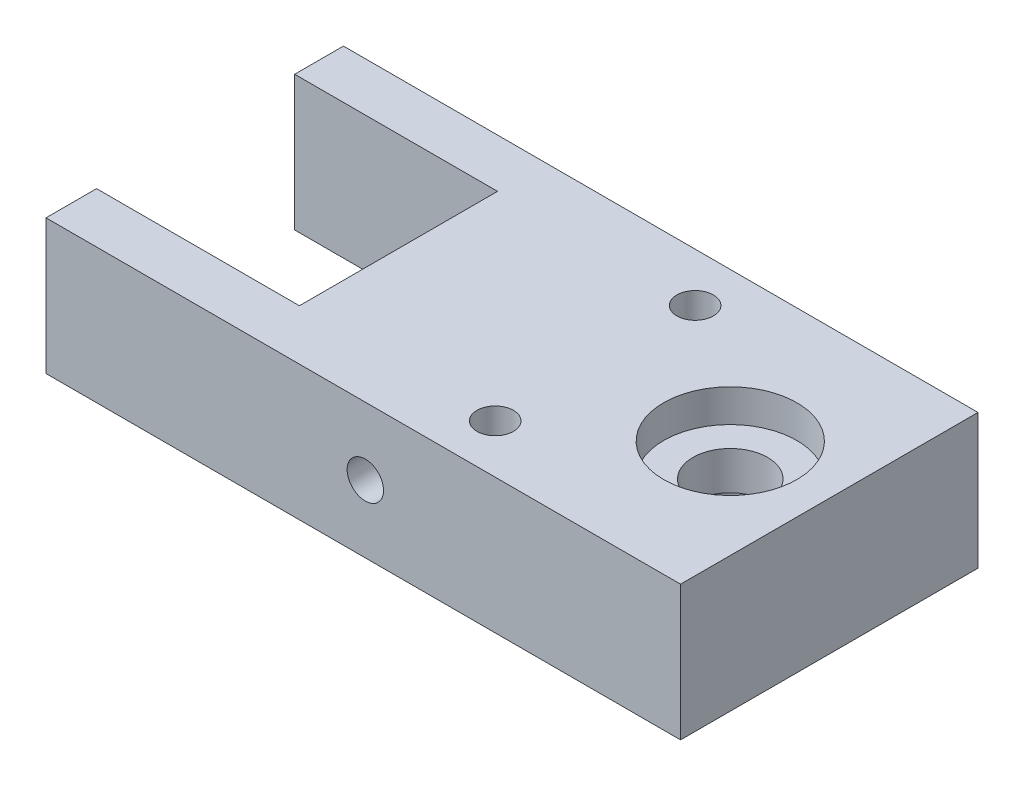
from build123d import *

# Parameters (mm, degrees)
SKETCH1_R           = 3.56
BOSS_EXTRUDE1_DEPTH = 12.86
SKETCH2_R           = 2.085
CUT_EXTRUDE1_DEPTH  = 12.7
SKETCH3_R           = 6.35
CUT_EXTRUDE2_DEPTH  = 3.12
SKETCH4_R           = 5.57
CUT_EXTRUDE3_DEPTH  = 6.08
SKETCH5_R           = 1.74
CUT_EXTRUDE4_DEPTH  = 55.530501556
SKETCH6_R           = 1.735
CUT_EXTRUDE5_DEPTH  = 5


with BuildPart() as part:
    # Sketch1 → Boss-Extrude1 (new body)
    with BuildSketch(Plane(origin=(0, 0, 0), x_dir=(1, 0, 0), z_dir=(0, 1, 0))):
        Polygon((-31.72, 9.53), (-31.72, -9.36), (-51.06, -9.36), (-51.06, -14.18), (9.44, -14.18), (9.44, 14.18), (-51.06, 14.18), (-51.06, 9.53), align=None)
        Circle(SKETCH1_R, mode=Mode.SUBTRACT)
    extrude(amount=BOSS_EXTRUDE1_DEPTH)

    # Sketch2 → Cut-Extrude1 (cut)
    with BuildSketch(Plane.ZY.offset(31.72)):
        with Locations((-0.085, 6.43)):
            Circle(SKETCH2_R)
    extrude(amount=-CUT_EXTRUDE1_DEPTH, mode=Mode.SUBTRACT)

    # Sketch3 → Cut-Extrude2 (cut)
    with BuildSketch(Plane(origin=(0, 12.86, 0), x_dir=(-1, 0, 0), z_dir=(0, 1, 0))):
        Circle(SKETCH3_R)
    extrude(amount=-CUT_EXTRUDE2_DEPTH, mode=Mode.SUBTRACT)

    # Sketch4 → Cut-Extrude3 (cut)
    with BuildSketch(Plane.XZ):
        Circle(SKETCH4_R)
    extrude(amount=-CUT_EXTRUDE3_DEPTH, mode=Mode.SUBTRACT)

    # Sketch5 → Cut-Extrude4 (cut, through all)
    with BuildSketch(Plane.XZ):
        with Locations((-12.88, -9.53)):
            Circle(SKETCH5_R)
        with Locations((-12.88, 9.53)):
            Circle(SKETCH5_R)
    extrude(amount=-CUT_EXTRUDE4_DEPTH, mode=Mode.SUBTRACT)

    # Sketch6 → Cut-Extrude5 (cut)
    with BuildSketch(Plane.XY.offset(14.18)):
        with Locations((-20.615, 6.43)):
            Circle(SKETCH6_R)
    extrude(amount=-CUT_EXTRUDE5_DEPTH, mode=Mode.SUBTRACT)


solid = part.part
